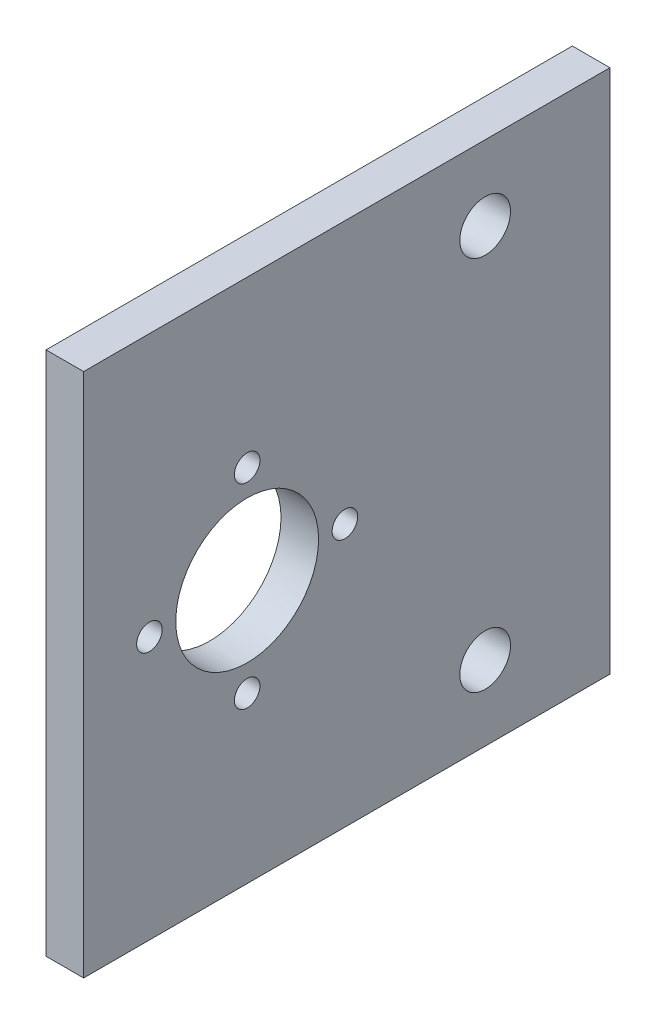
from build123d import *

# Parameters (mm, degrees)
SKETCH1_W           = 69.85
SKETCH1_H           = 70
SKETCH1_R           = 1.7
SKETCH1_R_2         = 9.5
SKETCH1_R_3         = 3.37312
BOSS_EXTRUDE1_DEPTH = 5


with BuildPart() as part:
    # Sketch1 → Boss-Extrude1 (new body)
    with BuildSketch(Plane.YZ):
        Rectangle(SKETCH1_W, SKETCH1_H)
        with Locations((0, 26.25)):
            Circle(SKETCH1_R, mode=Mode.SUBTRACT)
        with Locations((0, 0.25)):
            Circle(SKETCH1_R, mode=Mode.SUBTRACT)
        with Locations((-13, 13.25)):
            Circle(SKETCH1_R, mode=Mode.SUBTRACT)
        with Locations((13, 13.25)):
            Circle(SKETCH1_R, mode=Mode.SUBTRACT)
        with Locations((0, 13.25)):
            Circle(SKETCH1_R_2, mode=Mode.SUBTRACT)
        with Locations((-25, -18.4)):
            Circle(SKETCH1_R_3, mode=Mode.SUBTRACT)
        with Locations((25, -18.4)):
            Circle(SKETCH1_R_3, mode=Mode.SUBTRACT)
    extrude(amount=BOSS_EXTRUDE1_DEPTH)


solid = part.part
